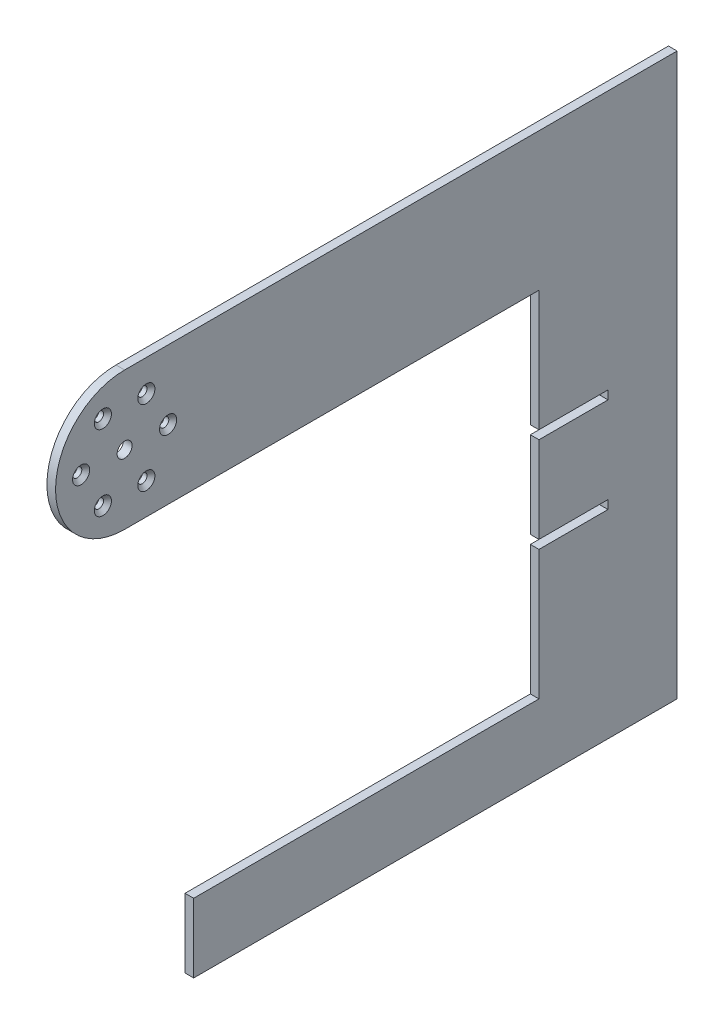
from build123d import *

# Parameters (mm, degrees)
BASE_FLANGE1_DEPTH                              = 3.175
SKETCH8_W                                       = 25.4
SKETCH8_H                                       = 3.175
CUT_EXTRUDE2_DEPTH                              = 251.830023684
SKETCH11_R                                      = 2.753999953
CUT_EXTRUDE4_DEPTH                              = 251.830023684
CSK_FOR_M3_FLAT_HEAD_MACHINE_SCREW1_D           = 3.4
CSK_FOR_M3_FLAT_HEAD_MACHINE_SCREW1_CSINK_D     = 6.3
CSK_FOR_M3_FLAT_HEAD_MACHINE_SCREW1_CSINK_ANGLE = 90


# Sheet-metal steps are written as plain solids
with BuildPart() as part:
    # Sketch1 → Base-Flange1 (new body)
    with BuildSketch(Plane(origin=(0, 0, 0), x_dir=(0, 0, -1), z_dir=(1, 0, 0))):
        with BuildLine():
            Line((0, -103.1875), (0, 103.1875))
            Line((0, 103.1875), (-203.2, 103.1875))
            ThreePointArc((-203.2, 103.1875), (-228.6, 77.7875), (-203.2, 52.3875))
            Line((-203.2, 52.3875), (-50.8, 52.3875))
            Line((-50.8, 52.3875), (-50.8, -77.7875))
            Line((-50.8, -77.7875), (-177.8, -77.7875))
            Line((-177.8, -77.7875), (-177.8, -103.1875))
            Line((-177.8, -103.1875), (-50.8, -103.1875))
            Line((-50.8, -103.1875), (0, -103.1875))
        make_face()
    extrude(amount=-BASE_FLANGE1_DEPTH)

    # Sketch8 → Cut-Extrude2 (cut, through all)
    with BuildSketch(Plane(origin=(0, 0, 0), x_dir=(0, 0, -1), z_dir=(1, 0, 0))):
        with Locations((-38.1, 6.35)):
            Rectangle(SKETCH8_W, SKETCH8_H)
        with Locations((-38.1, -28.575)):
            Rectangle(SKETCH8_W, SKETCH8_H)
    extrude(amount=-CUT_EXTRUDE2_DEPTH, mode=Mode.SUBTRACT)

    # Sketch11 → Cut-Extrude4 (cut, through all)
    with BuildSketch(Plane(origin=(0, 0, 0), x_dir=(0, 0, -1), z_dir=(1, 0, 0))):
        with Locations((-203.2, 77.7875)):
            Circle(SKETCH11_R)
    extrude(amount=-CUT_EXTRUDE4_DEPTH, mode=Mode.SUBTRACT)

    # CSK for M3 Flat Head Machine Screw1 (through all)
    with Locations(Plane(origin=(0, 0, 0), x_dir=(0, 0, -1), z_dir=(1, 0, 0))):
        with Locations((-211.2, 63.931093539), (-219.2, 77.7875), (-211.2, 91.643906461), (-195.2, 91.643906461), (-187.2, 77.7875), (-195.2, 63.931093539)):
            CounterSinkHole(CSK_FOR_M3_FLAT_HEAD_MACHINE_SCREW1_D / 2, CSK_FOR_M3_FLAT_HEAD_MACHINE_SCREW1_CSINK_D / 2, counter_sink_angle=CSK_FOR_M3_FLAT_HEAD_MACHINE_SCREW1_CSINK_ANGLE)


solid = part.part
